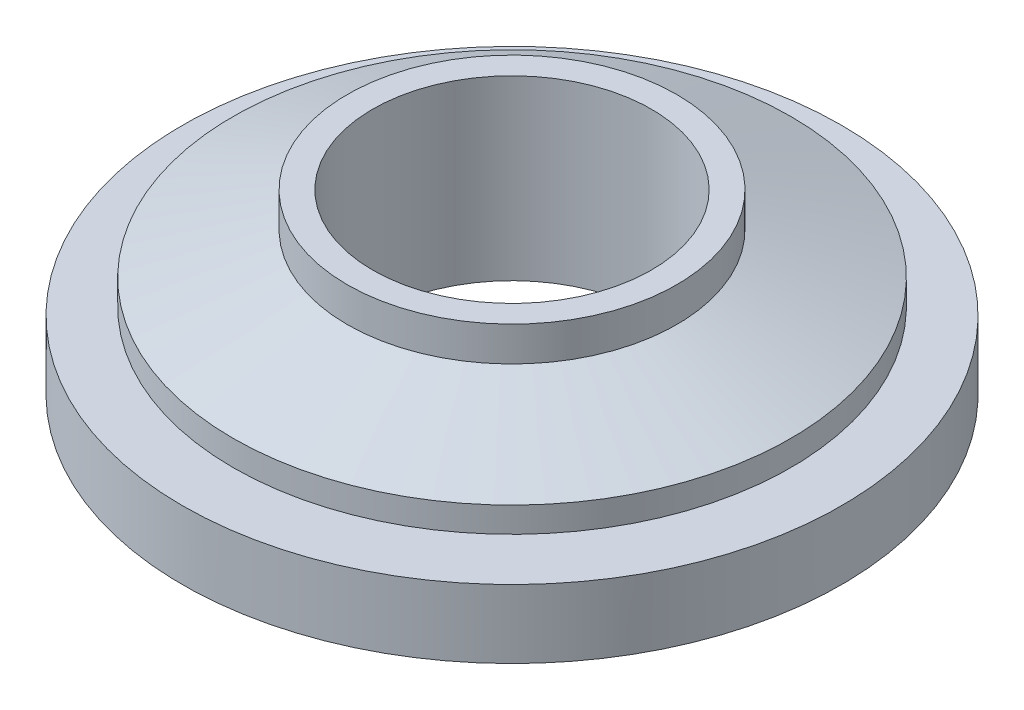
from build123d import *

# Parameters (mm, degrees)
SKETCH1_R           = 7
SKETCH1_R_2         = 5.5
BOSS_EXTRUDE1_DEPTH = 3
CHAMFER1_SIZE       = 0.4
CHAMFER1_SIZE2      = 1.098990968
SKETCH2_R           = 11
SKETCH2_R_2         = 5.5
BOSS_EXTRUDE2_DEPTH = 4
SKETCH3_OUTSIDE_W   = 30.378
SKETCH3_OUTSIDE_H   = 30.378
SKETCH3_OUTSIDE_R   = 6.5
CUT_EXTRUDE1_DEPTH  = 1
CHAMFER2_SIZE       = 2
CHAMFER2_SIZE_2     = 5.494954839
SKETCH5_R           = 13
SKETCH5_R_2         = 8.6
BOSS_EXTRUDE3_DEPTH = 2.7


with BuildPart() as part:
    # Sketch1 → Boss-Extrude1 (new body)
    with BuildSketch(Plane(origin=(0, 0, 0), x_dir=(1, 0, 0), z_dir=(0, 1, 0))):
        with Locations(Location((0, 0, 0), (0, 0, 270))):
            Circle(SKETCH1_R)
        with Locations(Location((0, 0, 0), (0, 0, 270))):
            Circle(SKETCH1_R_2, mode=Mode.SUBTRACT)
    extrude(amount=BOSS_EXTRUDE1_DEPTH)

    # Chamfer1
    chamfer1_edges = [part.edges().sort_by_distance(p)[0] for p in [
        (0, 0, -7),
    ]]
    chamfer1_side = [part.faces().sort_by_distance(p)[0] for p in [
        (0, 0, -6.802010101),
    ]]
    chamfer(chamfer1_edges, length=CHAMFER1_SIZE, length2=CHAMFER1_SIZE2, reference=chamfer1_side[0])

    # Sketch2 → Boss-Extrude2 (add)
    with BuildSketch(Plane(origin=(0, 3, 0), x_dir=(1, 0, 0), z_dir=(0, 1, 0))):
        with Locations(Location((0, 0, 0), (0, 0, 270))):
            Circle(SKETCH2_R)
        with Locations(Location((0, 0, 0), (0, 0, 270))):
            Circle(SKETCH2_R_2, mode=Mode.SUBTRACT)
    extrude(amount=BOSS_EXTRUDE2_DEPTH)

    # Sketch3 outside → Cut-Extrude1 (cut)
    with BuildSketch(Plane(origin=(0, 7, 0), x_dir=(1, 0, 0), z_dir=(0, 1, 0))):
        Rectangle(SKETCH3_OUTSIDE_W, SKETCH3_OUTSIDE_H)
        with Locations(Location((0, 0, 0), (0, 0, 270))):
            Circle(SKETCH3_OUTSIDE_R, mode=Mode.SUBTRACT)
    extrude(amount=-CUT_EXTRUDE1_DEPTH, mode=Mode.SUBTRACT)

    # Chamfer2
    # the kernel refuses this chamfer: 5.494954839, 2 mm, written as the material it takes off along each edge
    with BuildSketch(Plane(origin=(0, 6, 0), x_dir=(0, 0, 1), z_dir=(1, 0, 0))) as chamfer2_piece_1_section:
        Polygon((11, CHAMFER2_SIZE), (11 - CHAMFER2_SIZE_2, 0), (11, 0), align=None)
    chamfer2_piece_1 = revolve(axis=Axis((0, 6, 0), (0, -1, 0)), mode=Mode.PRIVATE)
    chamfer2_piece_1 = chamfer2_piece_1 - Plane(origin=(0, 4.848037637, 0), x_dir=(0, 0, 1), z_dir=(0, 1, 0)) * Cylinder(6.5, 44, mode=Mode.PRIVATE)
    add(chamfer2_piece_1, mode=Mode.SUBTRACT)


with BuildPart() as body_2:
    # Sketch5 → Boss-Extrude3 (new body)
    with BuildSketch(Plane.XZ):
        with Locations(Location((0, 0, 0), (0, 0, 270))):
            Circle(SKETCH5_R)
        with Locations(Location((0, 0, 0), (0, 0, 270))):
            Circle(SKETCH5_R_2, mode=Mode.SUBTRACT)
    extrude(amount=-BOSS_EXTRUDE3_DEPTH)


solid = Compound([part.part, body_2.part])
